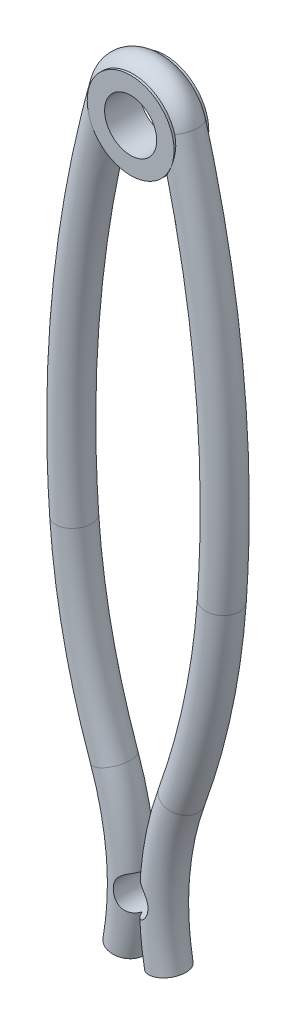
from build123d import *

# Parameters (mm, degrees)
SKETCH5_R               = 1.27
CUT_EXTRUDE1_DEPTH      = 36.681746077
CUT_EXTRUDE1_DEPTH_BACK = 36.681746077
SKETCH6_R               = 1.27
SKETCH7_R               = 3.175
EXTRUDE1_DEPTH          = 1.27
SKETCH8_R               = 1.905
CUT_EXTRUDE2_DEPTH      = 36.749485358


with BuildPart() as part:
    # Sweep1: sweep along a path in Sketch4
    with BuildLine(Plane.XY) as sweep1_path:
        ThreePointArc((1.524, -21.932836987), (1.258560955, -16.26346617), (2.466131445, -10.717837544))
        ThreePointArc((2.466131445, -10.717837544), (4.407009442, -3.88086265), (5.397406612, 3.156917294))
        ThreePointArc((5.397406612, 3.156917294), (5.172161483, 17.643381967), (2.443577881, 31.87233926))
        ThreePointArc((2.443577881, 31.87233926), (1.531481366, 33.205506007), (0, 33.719138611))
    # Sketch5 → Sweep1 (sweep)
    with BuildSketch(Plane(origin=(0, 0, 0), x_dir=(0, 0, -1), z_dir=(1, 0, 0))):
        with Locations((0, 33.719138611)):
            Circle(SKETCH5_R)
    sweep1 = sweep(path=sweep1_path.line)

    # Mirror1: Sweep1 across plane
    add(sweep1.mirror(Plane(origin=(0, 0, 0), x_dir=(0, 0, 1), z_dir=(1, 0, 0))))

    # Sketch6 → Cut-Extrude1 (cut, two sides: drawn at the far end of the back side and taken through both)
    with BuildSketch(Plane.XY.offset(-CUT_EXTRUDE1_DEPTH_BACK)):
        with Locations((0, -17.78)):
            Circle(SKETCH6_R)
    extrude(amount=CUT_EXTRUDE1_DEPTH + CUT_EXTRUDE1_DEPTH_BACK, mode=Mode.SUBTRACT)

    # Sketch7 → Extrude1 (add, symmetric)
    with BuildSketch(Plane.XY):
        with Locations((0, 31.179138611)):
            Circle(SKETCH7_R)
    extrude(amount=EXTRUDE1_DEPTH, both=True)

    # Sketch8 → Cut-Extrude2 (cut, through all)
    with BuildSketch(Plane.XY.offset(1.27)):
        with Locations((0, 31.179138611)):
            Circle(SKETCH8_R)
    extrude(amount=-CUT_EXTRUDE2_DEPTH, mode=Mode.SUBTRACT)


solid = part.part
